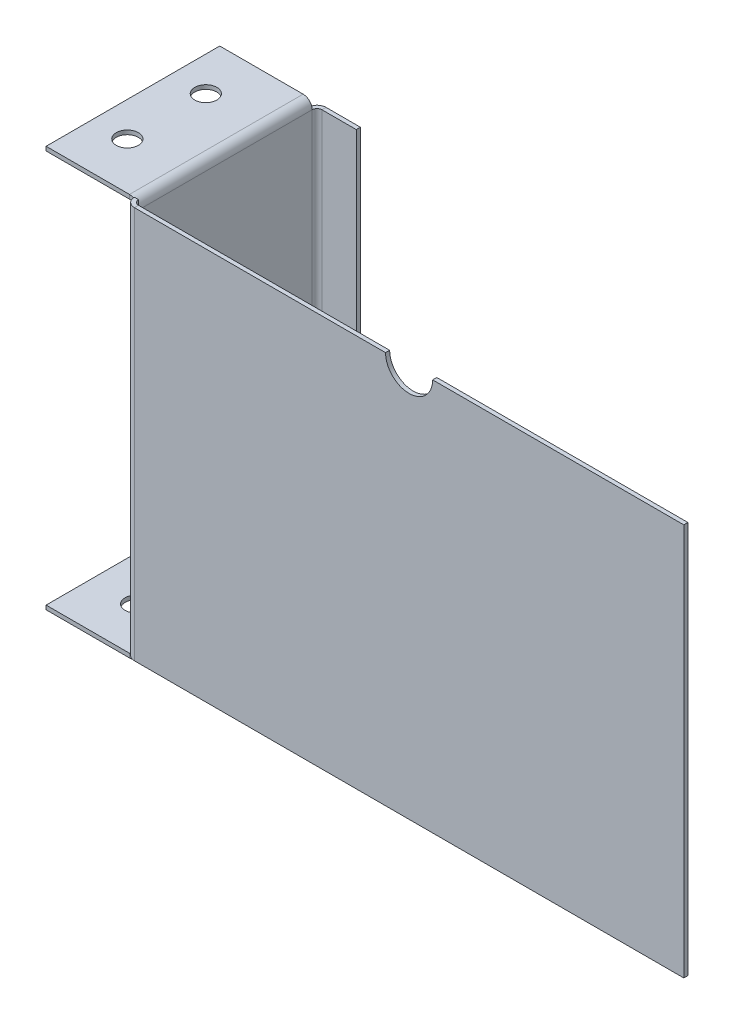
from build123d import *

# Parameters (mm, degrees)
BASE_FLANGE1_DEPTH           = 2.65684
EDGE_FLANGE1_DEPTH           = 254
EDGE_FLANGE2_STRIP_W         = 16.97736
EDGE_FLANGE2_STRIP_H         = 2.65684
EDGE_FLANGE2_STRIP_CUT_DEPTH = 112.395
EDGE_FLANGE2_DEPTH           = 112.395
EDGE_FLANGE3_DEPTH           = 112.395
EDGE_FLANGE4_DEPTH           = 248.16816
SKETCH22_R                   = 7.14375
CUT_EXTRUDE1_DEPTH           = 2.65684
SKETCH23_R                   = 7.14375
CUT_EXTRUDE2_DEPTH           = 2.65684
SKETCH24_R                   = 7.14375
CUT_EXTRUDE3_DEPTH           = 2.65684


# Sheet-metal steps are written as plain solids
with BuildPart() as part:
    # Sketch1 → Base-Flange1 (new body)
    with BuildSketch(Plane.XY):
        with BuildLine():
            Line((0, 0), (355.6, 0))
            Line((355.6, 0), (355.6, 254))
            Line((355.6, 254), (193.04, 254))
            ThreePointArc((193.04, 254), (177.8, 238.76), (162.56, 254))
            Line((162.56, 254), (0, 254))
            Line((0, 254), (0, 0))
        make_face()
    extrude(amount=-BASE_FLANGE1_DEPTH)

    # Edge-Flange1 section (across the edge) → Edge-Flange1 (add)
    with BuildSketch(Plane(origin=(-3.175, 0, -2.65684), x_dir=(1, 0, 0), z_dir=(0, 1, 0))):
        with BuildLine():
            Line((-2.65684, 3.175), (-2.65684, 115.57))
            Line((-2.65684, 115.57), (0, 115.57))
            Line((0, 115.57), (0, 3.175))
            ThreePointArc((0, 3.175), (0.92993597, 0.92993597), (3.175, 0))
            Line((3.175, 0), (3.175, -2.65684))
            ThreePointArc((3.175, -2.65684), (-0.948733611, -0.948733611), (-2.65684, 3.175))
        make_face()
    extrude(amount=EDGE_FLANGE1_DEPTH)

    # Edge-Flange2 strip (across the edge) → Edge-Flange2 strip cut (cut)
    with BuildSketch(Plane(origin=(-5.83184, 254, -5.83184), x_dir=(0, -1, 0), z_dir=(0, 0, -1))):
        with Locations((-2.65684, -1.32842)):
            Rectangle(EDGE_FLANGE2_STRIP_W, EDGE_FLANGE2_STRIP_H)
    extrude(amount=EDGE_FLANGE2_STRIP_CUT_DEPTH, mode=Mode.SUBTRACT)

    # Edge-Flange2 section (across the edge) → Edge-Flange2 (add)
    with BuildSketch(Plane(origin=(-5.83184, 254, -5.83184), x_dir=(0, -1, 0), z_dir=(0, 0, -1))):
        with BuildLine():
            Line((0, 3.175), (0, 57.15))
            Line((0, 57.15), (2.65684, 57.15))
            Line((2.65684, 57.15), (2.65684, 3.175))
            ThreePointArc((2.65684, 3.175), (3.58677597, 0.92993597), (5.83184, 0))
            Line((5.83184, 0), (5.83184, -2.65684))
            ThreePointArc((5.83184, -2.65684), (1.708106389, -0.948733611), (0, 3.175))
        make_face()
    extrude(amount=EDGE_FLANGE2_DEPTH)

    # Edge-Flange3 section (across the edge) → Edge-Flange3 (add)
    with BuildSketch(Plane(origin=(-5.83184, -3.175, -118.22684), x_dir=(0, 1, 0), z_dir=(0, 0, 1))):
        with BuildLine():
            Line((-2.65684, 3.175), (-2.65684, 57.15))
            Line((-2.65684, 57.15), (0, 57.15))
            Line((0, 57.15), (0, 3.175))
            ThreePointArc((0, 3.175), (0.92993597, 0.92993597), (3.175, 0))
            Line((3.175, 0), (3.175, -2.65684))
            ThreePointArc((3.175, -2.65684), (-0.948733611, -0.948733611), (-2.65684, 3.175))
        make_face()
    extrude(amount=EDGE_FLANGE3_DEPTH)

    # Edge-Flange4 section (across the edge) → Edge-Flange4 (add)
    with BuildSketch(Plane(origin=(-3.175, 0, -121.40184), x_dir=(0, 0, 1), z_dir=(0, 1, 0))):
        with BuildLine():
            Line((-2.65684, 3.175), (-2.65684, 25.4))
            Line((-2.65684, 25.4), (0, 25.4))
            Line((0, 25.4), (0, 3.175))
            ThreePointArc((0, 3.175), (0.92993597, 0.92993597), (3.175, 0))
            Line((3.175, 0), (3.175, -2.65684))
            ThreePointArc((3.175, -2.65684), (-0.948733611, -0.948733611), (-2.65684, 3.175))
        make_face()
    extrude(amount=EDGE_FLANGE4_DEPTH)

    # Sketch22 → Cut-Extrude1 (cut)
    with BuildSketch(Plane(origin=(0, 254, 0), x_dir=(1, 0, 0), z_dir=(0, 1, 0))):
        with Locations(Location((-40.76446, 86.995, 0), (0, 0, 180))):
            Circle(SKETCH22_R)
        with Locations(Location((-40.76446, 36.195, 0), (0, 0, 180))):
            Circle(SKETCH22_R)
    extrude(amount=-CUT_EXTRUDE1_DEPTH, mode=Mode.SUBTRACT)

    # Sketch23 → Cut-Extrude2 (cut)
    with BuildSketch(Plane(origin=(0, -3.175, 0), x_dir=(1, 0, 0), z_dir=(0, 1, 0))):
        with Locations(Location((-34.40684, 86.36, 0), (0, 0, 180))):
            Circle(SKETCH23_R)
        with Locations(Location((-34.40684, 35.56, 0), (0, 0, 180))):
            Circle(SKETCH23_R)
    extrude(amount=-CUT_EXTRUDE2_DEPTH, mode=Mode.SUBTRACT)

    # Sketch24 → Cut-Extrude3 (cut)
    with BuildSketch(Plane.ZY.offset(5.83184)):
        with Locations((-86.995, 41.79316)):
            Circle(SKETCH24_R)
        with Locations((-34.40684, 41.79316)):
            Circle(SKETCH24_R)
    extrude(amount=-CUT_EXTRUDE3_DEPTH, mode=Mode.SUBTRACT)


solid = part.part
